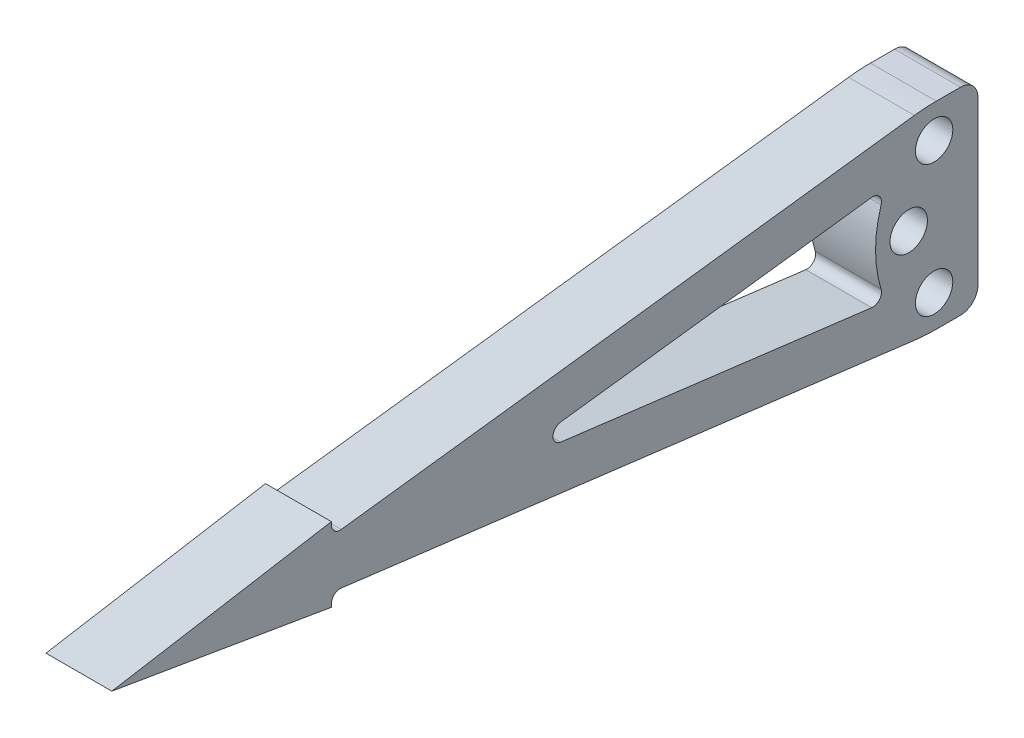
from build123d import *

# Parameters (mm, degrees)
STOCK_BUMBLE_START            = -47.625
STOCK_BUMBLE_BYTE_1_OUTLINE_R = 2.7051
STOCK_BUMBLE_BYTE_1_DEPTH     = 9.525
FILLET1_R                     = 2.54
FILLET2_R                     = 1.27
FILLET3_R                     = 1.27
FILLET4_R                     = 25.4


# Read off the part's stored shape, not the designer's step: Stock-Bumble Byte-1
with BuildPart() as part:
    # Stock-Bumble Byte-1 outline → Stock-Bumble Byte-1 (new body)
    with BuildSketch(Plane.YZ.offset(STOCK_BUMBLE_START)):
        Polygon((21.9075, 120.65), (11.1125, 34.7472), (11.1125, 27.1272), (39.6875, 27.1272), (39.6875, 34.7472), (28.8925, 120.65), (30.766729518, 120.65), (25.4, 152.4), (20.033270482, 120.65), align=None)
        with Locations((15.875, 33.4772)):
            Circle(STOCK_BUMBLE_BYTE_1_OUTLINE_R, mode=Mode.SUBTRACT)
        with Locations((25.4, 37.143795847)):
            Circle(STOCK_BUMBLE_BYTE_1_OUTLINE_R, mode=Mode.SUBTRACT)
        with Locations((34.925, 33.4772)):
            Circle(STOCK_BUMBLE_BYTE_1_OUTLINE_R, mode=Mode.SUBTRACT)
        with BuildLine():
            ThreePointArc((32.573016025, 40.433269228), (25.4, 41.944395847), (18.226983975, 40.433269228))
            Line((18.226983975, 40.433269228), (25.4, 97.513599106))
            Line((25.4, 97.513599106), (32.573016025, 40.433269228))
        make_face(mode=Mode.SUBTRACT)
    extrude(amount=STOCK_BUMBLE_BYTE_1_DEPTH)

    # Fillet1
    fillet1_edges = [part.edges().sort_by_distance(p)[0] for p in [
        (-42.8625, 11.1125, 27.1272),
        (-42.8625, 39.6875, 27.1272),
    ]]
    fillet(fillet1_edges, radius=FILLET1_R)

    # Fillet2
    fillet2_edges = [part.edges().sort_by_distance(p)[0] for p in [
        (-42.8625, 18.226983975, 40.433269228),
        (-42.8625, 32.573016025, 40.433269228),
        (-42.8625, 25.4, 97.513599106),
    ]]
    fillet(fillet2_edges, radius=FILLET2_R)

    # Fillet3
    fillet3_edges = [part.edges().sort_by_distance(p)[0] for p in [
        (-42.8625, 28.8925, 120.65),
        (-42.8625, 21.9075, 120.65),
    ]]
    fillet(fillet3_edges, radius=FILLET3_R)

    # Fillet4
    fillet4_edges = [part.edges().sort_by_distance(p)[0] for p in [
        (-42.8625, 11.1125, 34.7472),
        (-42.8625, 39.6875, 34.7472),
    ]]
    fillet(fillet4_edges, radius=FILLET4_R)


solid = part.part
